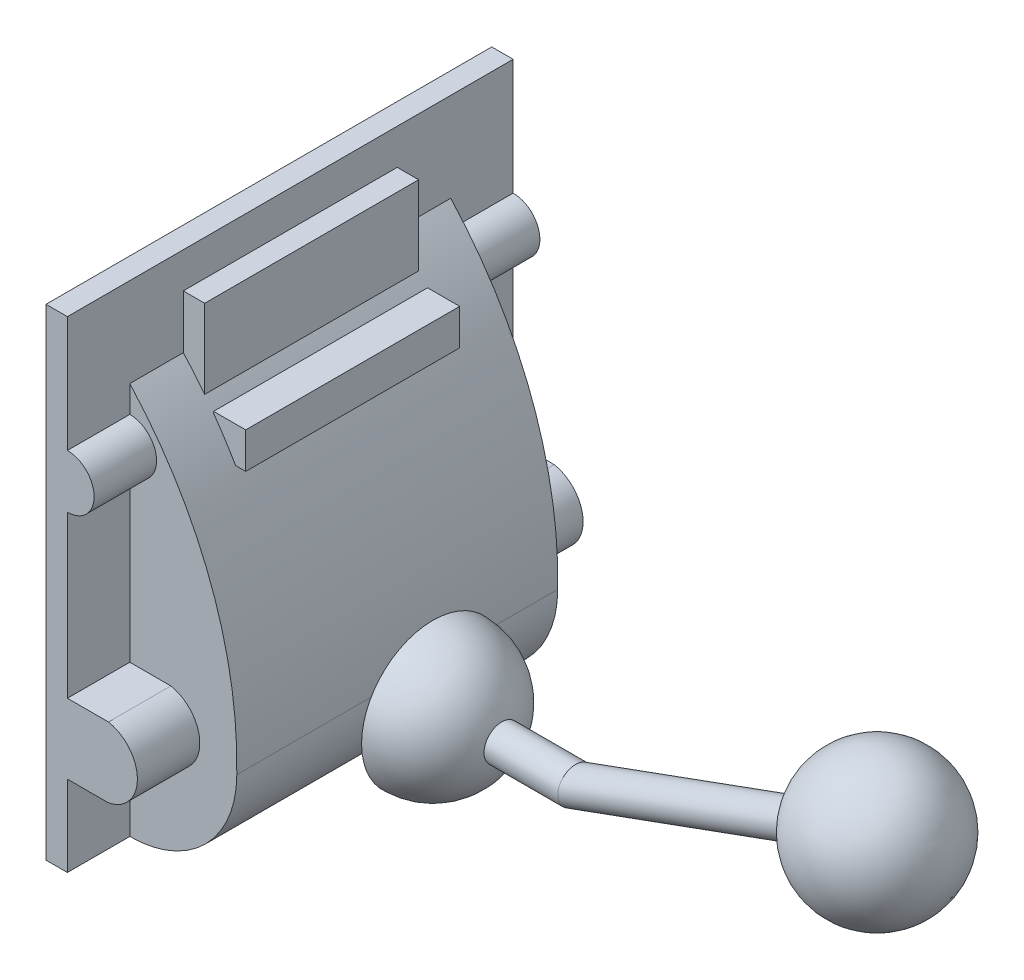
from build123d import *

# Parameters (mm, degrees)
BOSS_EXTRUDE1_DEPTH = 90
SKETCH2_W           = 250
SKETCH2_H           = 270
BOSS_EXTRUDE2_DEPTH = 12
SKETCH3_W           = 12
SKETCH3_H           = 71.994382314
SKETCH3_W_2         = 18
SKETCH3_H_2         = 20.175474964
BOSS_EXTRUDE3_DEPTH = 60
BOSS_EXTRUDE4_REACH = 374.836
SKETCH5_R           = 10
BOSS_EXTRUDE5_DEPTH = 160


with BuildPart() as part:
    # Sketch1 → Boss-Extrude1 (new, symmetric)
    with BuildSketch(Plane.XY):
        with BuildLine():
            Line((0, 0), (0, 220))
            ThreePointArc((0, 220), (45.41051287, 145.778942326), (60, 60))
            ThreePointArc((60, 60), (42.426406871, 17.573593129), (0, 0))
        make_face()
    extrude(amount=BOSS_EXTRUDE1_DEPTH, both=True)

    # Sketch2 → Boss-Extrude2 (add)
    with BuildSketch(Plane.ZY):
        with Locations((0, 135)):
            Rectangle(SKETCH2_W, SKETCH2_H)
    extrude(amount=BOSS_EXTRUDE2_DEPTH)

    # Sketch3 → Boss-Extrude3 (add, symmetric)
    with BuildSketch(Plane.XY):
        with Locations((6, 214.002808843)):
            Rectangle(SKETCH3_W, SKETCH3_H)
        with Locations((26, 189.912262518)):
            Rectangle(SKETCH3_W_2, SKETCH3_H_2)
    extrude(amount=BOSS_EXTRUDE3_DEPTH, both=True)

    # Boss-Extrude4: up to this face of the body (flat: up to its plane)
    boss_extrude4_end = Plane(part.part.faces().sort_by_distance((-6, 135, -125))[0])
    # Sketch4 → Boss-Extrude4 (add, up to the picked face)
    with BuildSketch(Plane.XY.offset(125), mode=Mode.PRIVATE) as boss_extrude4_sk1:
        with BuildLine():
            Line((0, 84.640792399), (23.027526502, 84.640792399))
            ThreePointArc((23.027526502, 84.640792399), (39.254030252, 65), (23.027526502, 45.359207601))
            Line((23.027526502, 45.359207601), (0, 45.359207601))
            Line((0, 45.359207601), (0, 84.640792399))
        make_face()
    boss_extrude4_tool1 = split(extrude(boss_extrude4_sk1.sketch, amount=-BOSS_EXTRUDE4_REACH, mode=Mode.PRIVATE), bisect_by=boss_extrude4_end, keep=Keep.BOTH, mode=Mode.PRIVATE)
    # Sketch4 → Boss-Extrude4 (add, up to the picked face)
    with BuildSketch(Plane.XY.offset(125), mode=Mode.PRIVATE) as boss_extrude4_sk2:
        with BuildLine():
            Line((0, 205), (0, 175))
            ThreePointArc((0, 175), (15, 190), (0, 205))
        make_face()
    boss_extrude4_tool2 = split(extrude(boss_extrude4_sk2.sketch, amount=-BOSS_EXTRUDE4_REACH, mode=Mode.PRIVATE), bisect_by=boss_extrude4_end, keep=Keep.BOTH, mode=Mode.PRIVATE)
    add(boss_extrude4_tool1.solids().sort_by(Axis((17.843581, 65, 125), (0, 0, -1)))[0])
    add(boss_extrude4_tool2.solids().sort_by(Axis((6.366198, 190, 125), (0, 0, -1)))[0])

    # Sketch5 → Boss-Extrude5 (add)
    with BuildSketch(Plane(origin=(0, 0, 0), x_dir=(0, 0, -1), z_dir=(1, 0, 0))):
        with Locations((0, 60)):
            Circle(SKETCH5_R)
    extrude(amount=BOSS_EXTRUDE5_DEPTH)

    # Sweep1: read off the stored shape, not the designer's step
    # Sweep1: loft between two sections, ruled curve by curve
    sweep1_from = [
        Edge.make_bspline([(160, 60, -10), (160, 80, -10), (160, 80, 10), (160, 60, 10), (160, 40, 10), (160, 40, -10), (160, 60, -10)], [0, 0, 0, 0, 0.5, 0.5, 0.5, 1, 1, 1, 1], 3, [1, 0.333333333, 0.333333333, 1, 0.333333333, 0.333333333, 1]),
    ]
    sweep1_to = [
        Edge.make_bspline([(329.144671741, 121.563625799, -10), (329.144671741, 141.563625799, -10), (329.144671741, 141.563625799, 10), (329.144671741, 121.563625799, 10), (329.144671741, 101.563625799, 10), (329.144671741, 101.563625799, -10), (329.144671741, 121.563625799, -10)], [0, 0, 0, 0, 0.5, 0.5, 0.5, 1, 1, 1, 1], 3, [1, 0.333333333, 0.333333333, 1, 0.333333333, 0.333333333, 1]),
    ]
    sweep1 = Solid(Shell([*[Face.make_surface_from_curves(sweep1_from[k], sweep1_to[k]) for k in range(1)], Face(Wire(sweep1_from)), Face(Wire(sweep1_to))]))
    add(sweep1)


with BuildPart() as body_2:
    # Sketch6 → Revolve1 (revolve)
    with BuildSketch(Plane(origin=(0, 60, 0), x_dir=(-1, 0, 0), z_dir=(0, -1, 0))):
        with BuildLine():
            Line((-80, 0), (-80, -40))
            ThreePointArc((-80, -40), (-108.284271247, -28.284271247), (-120, 0))
            Line((-120, 0), (-80, 0))
        make_face()
    revolve(axis=Axis((120, 60, 0), (-1, 0, 0)))


with BuildPart() as body_3:
    # Sketch11 → Revolve2 (revolve)
    with BuildSketch(Plane.XY):
        with BuildLine():
            Line((329.144671741, 161.563625799), (329.144671741, 81.563625799))
            ThreePointArc((329.144671741, 81.563625799), (369.144671741, 121.563625799), (329.144671741, 161.563625799))
        make_face()
    revolve(axis=Axis((329.144671741, 161.563625799, 0), (0, -1, 0)))


solid = Compound([part.part, body_2.part, body_3.part])
